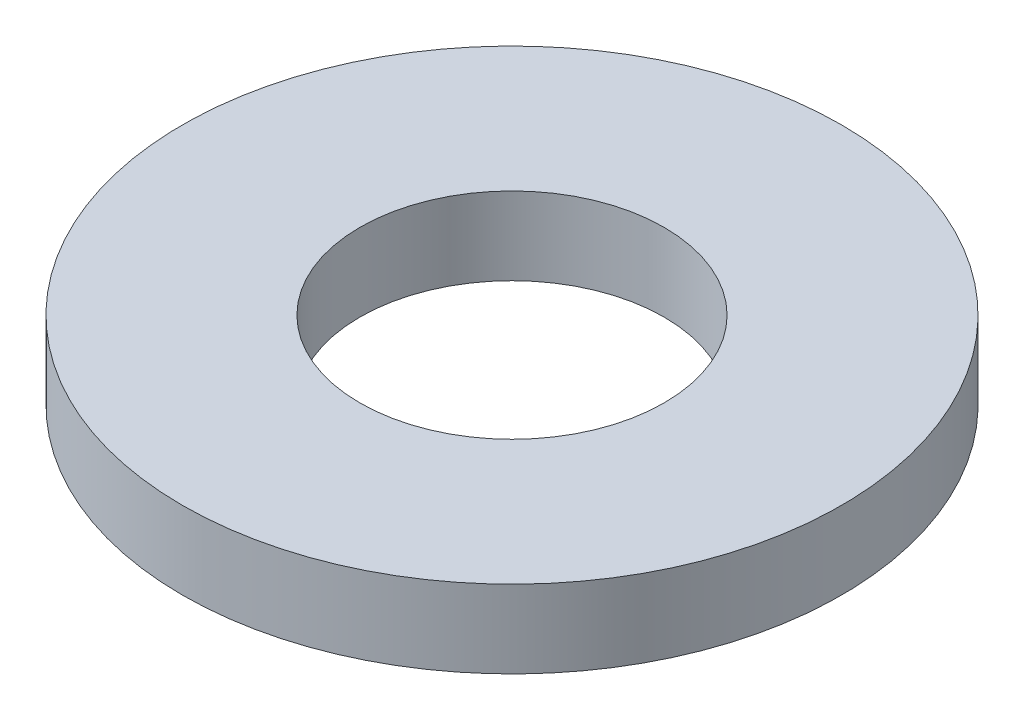
from build123d import *

# Parameters (mm, degrees)
SKETCH1_R           = 97.5
BOSS_EXTRUDE1_DEPTH = 23
SKETCH2_R           = 45
CUT_EXTRUDE1_DEPTH  = 140.790915299


with BuildPart() as part:
    # Sketch1 → Boss-Extrude1 (new body)
    with BuildSketch(Plane(origin=(0, 0, 0), x_dir=(1, 0, 0), z_dir=(0, 1, 0))):
        Circle(SKETCH1_R)
    extrude(amount=BOSS_EXTRUDE1_DEPTH)

    # Sketch2 → Cut-Extrude1 (cut, through all)
    with BuildSketch(Plane(origin=(0, 0, 0), x_dir=(1, 0, 0), z_dir=(0, 1, 0))):
        Circle(SKETCH2_R)
    extrude(amount=CUT_EXTRUDE1_DEPTH, mode=Mode.SUBTRACT)


solid = part.part
